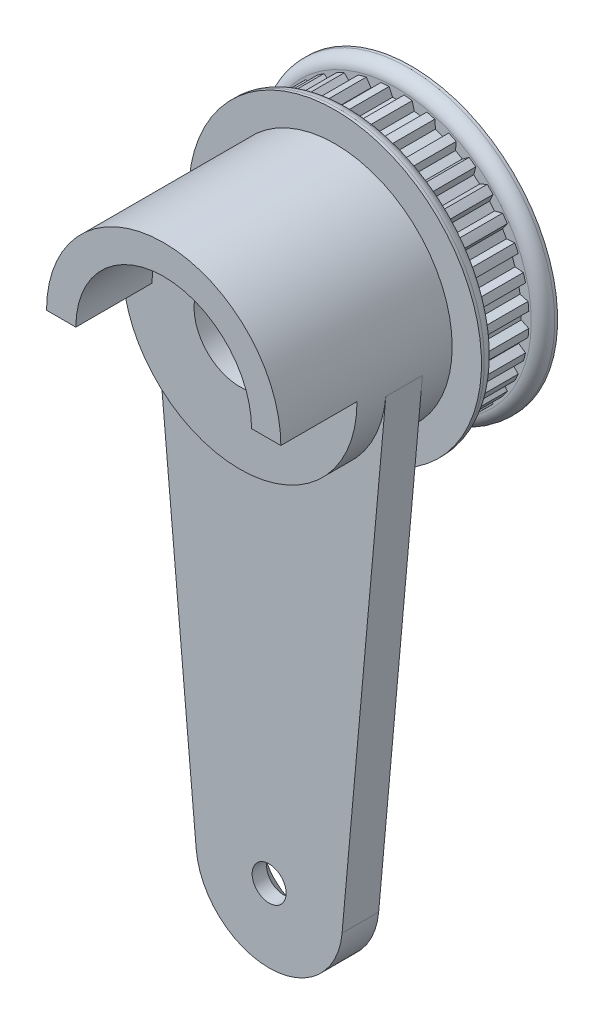
from build123d import *

# Parameters (mm, degrees)
SKETCH1_R                                         = 13.97
BOSS_EXTRUDE1_DEPTH                               = 12.7
SKETCH2_W                                         = 11.176
SKETCH2_H                                         = 10.668
FILLET2_R                                         = 0.2794
CUT_EXTRUDE1_DEPTH                                = 31.990081987
FILLET1_R                                         = 0.5984748
CIRPATTERN1_COUNT                                 = 20
FILLET1_OF_CIRPATTERN1_R                          = 0.5984748
SKETCH5_R                                         = 6.35
CUT_EXTRUDE2_DEPTH                                = 31.978829136
CHAMFER1_SIZE                                     = 0.5334
SKETCH7_R                                         = 15.875
CUT_EXTRUDE6_DEPTH                                = 2.54
SKETCH6_R                                         = 15.875
CUT_EXTRUDE7_DEPTH                                = 16.5735
SKETCH9_R                                         = 6.35
SKETCH9_R_2                                       = 3.96875
BOSS_EXTRUDE3_DEPTH                               = 4.7625
BOSS_EXTRUDE2_START                               = 3.175
SKETCH8_R                                         = 3.96875
BOSS_EXTRUDE2_DEPTH                               = 3.175
BOSS_EXTRUDE4_START                               = 2.54
SKETCH10_R                                        = 10.16
SKETCH10_R_2                                      = 3.96875
BOSS_EXTRUDE4_DEPTH                               = 2.54
BOSS_EXTRUDE5_START                               = 6.604
BOSS_EXTRUDE5_DEPTH                               = 6.604
SKETCH13_R                                        = 15.875
CUT_EXTRUDE8_DEPTH                                = 4.7625
SKETCH18_R                                        = 10.16
SKETCH18_R_2                                      = 3.96875
BOSS_EXTRUDE10_DEPTH                              = 2.54
SKETCH16_R                                        = 12.7
SKETCH16_R_2                                      = 3.96875
BOSS_EXTRUDE8_DEPTH                               = 1.27
SKETCH14_R                                        = 3.96875
BOSS_EXTRUDE6_DEPTH                               = 4.064
SKETCH15_R                                        = 12.7
SKETCH15_R_2                                      = 3.96875
BOSS_EXTRUDE7_DEPTH                               = 1.27
FILLET3_R                                         = 1.016
CSK_FOR_4_FLAT_HEAD_MACHINE_SCREW_100_D           = 2.9464
CSK_FOR_4_FLAT_HEAD_MACHINE_SCREW_100_CSINK_D     = 7.531227
CSK_FOR_4_FLAT_HEAD_MACHINE_SCREW_100_CSINK_ANGLE = 100


with BuildPart() as part:
    # Sketch1 → Boss-Extrude1 (new body)
    with BuildSketch(Plane.XY):
        Circle(SKETCH1_R)
    extrude(amount=-BOSS_EXTRUDE1_DEPTH)

    # Sketch2 → Revolve1 (revolve)
    with BuildSketch(Plane(origin=(0, 0, 0), x_dir=(0, 0, -1), z_dir=(1, 0, 0)), mode=Mode.PRIVATE) as revolve1_sk:
        with Locations((18.288, 5.334)):
            Rectangle(SKETCH2_W, SKETCH2_H)
    revolve(revolve1_sk.sketch.rotate(Axis((0, 0, -12.7), (0, 0, -1)), 90), axis=Axis((0, 0, -12.7), (0, 0, -1)))

    # Fillet2
    fillet2_edges = [part.edges().sort_by_distance(p)[0] for p in [
        (-13.97, 0, 0),
        (-13.97, 0, -12.7),
        (-10.668, 0, -12.7),
    ]]
    fillet(fillet2_edges, radius=FILLET2_R)

    # Sketch4 → Cut-Extrude1 (cut, through all)
    with BuildSketch(Plane.XY):
        with BuildLine():
            Line((0.210823499, 11.932233972), (0.210823499, 11.228631013))
            ThreePointArc((0.210823499, 11.228631013), (0.881145561, 11.195989616), (1.54832106, 11.123367425))
            Line((1.54832106, 11.123367425), (1.658389068, 11.818307824))
            add(Edge.make_bspline(
                [(5.904499611, 15.819097373), (2.715567633, 14.578951978), (1.658389068, 11.818307824)],
                knots=[0, 0, 0, 1, 1, 1], degree=2))
            ThreePointArc((5.904499611, 15.819097373), (1.324793594, 16.833059119), (-3.35714731, 16.548006506))
            add(Edge.make_bspline(
                [(-3.35714731, 16.548006506), (-0.40147849, 14.824269404), (0.210823499, 11.932233972)],
                knots=[0, 0, 0, 1, 1, 1], degree=2))
        make_face()
    cut_extrude1 = extrude(amount=-CUT_EXTRUDE1_DEPTH, mode=Mode.SUBTRACT)

    # Fillet1
    fillet1_edges = [part.edges().sort_by_distance(p)[0] for p in [
        (1.54832106, 11.123367425, -6.35),
        (0.210823499, 11.228631013, -6.35),
    ]]
    fillet(fillet1_edges, radius=FILLET1_R)

    # CirPattern1: Cut-Extrude1 ×20 about axis
    cirpattern1_axis = Axis((0, 0, -12.7), (0, 0, 1))
    for i in range(1, CIRPATTERN1_COUNT):
        add(cut_extrude1.rotate(cirpattern1_axis, i * 360 / CIRPATTERN1_COUNT), mode=Mode.SUBTRACT)

    # Fillet1 of CirPattern1
    fillet1_of_cirpattern1_edges = [part.edges().sort_by_distance(p)[0] for p in [
        (-1.964768736, 11.057408593, -6.35),
        (-3.269332744, 10.744210738, -6.35),
        (-5.285533278, 9.909073566, -6.35),
        (-6.429463919, 9.208072256, -6.35),
        (-8.088912997, 7.790769378, -6.35),
        (-8.96023437, 6.770583506, -6.35),
        (-10.100493552, 4.909850402, -6.35),
        (-10.61391465, 3.670342869, -6.35),
        (-11.123367425, 1.54832106, -6.35),
        (-11.228631013, 0.210823499, -6.35),
        (-11.057408593, -1.964768736, -6.35),
        (-10.744210738, -3.269332744, -6.35),
        (-9.909073566, -5.285533278, -6.35),
        (-9.208072256, -6.429463919, -6.35),
        (-7.790769378, -8.088912997, -6.35),
        (-6.770583506, -8.96023437, -6.35),
        (-4.909850402, -10.100493552, -6.35),
        (-3.670342869, -10.61391465, -6.35),
        (-1.54832106, -11.123367425, -6.35),
        (-0.210823499, -11.228631013, -6.35),
        (1.964768736, -11.057408593, -6.35),
        (3.269332744, -10.744210738, -6.35),
        (5.285533278, -9.909073566, -6.35),
        (6.429463919, -9.208072256, -6.35),
        (8.088912997, -7.790769378, -6.35),
        (8.96023437, -6.770583506, -6.35),
        (10.100493552, -4.909850402, -6.35),
        (10.61391465, -3.670342869, -6.35),
        (11.123367425, -1.54832106, -6.35),
        (11.228631013, -0.210823499, -6.35),
        (11.057408593, 1.964768736, -6.35),
        (10.744210738, 3.269332744, -6.35),
        (9.909073566, 5.285533278, -6.35),
        (9.208072256, 6.429463919, -6.35),
        (7.790769378, 8.088912997, -6.35),
        (6.770583506, 8.96023437, -6.35),
        (4.909850402, 10.100493552, -6.35),
        (3.670342869, 10.61391465, -6.35),
    ]]
    fillet(fillet1_of_cirpattern1_edges, radius=FILLET1_OF_CIRPATTERN1_R)

    # Sketch5 → Cut-Extrude2 (cut, through all)
    with BuildSketch(Plane.XY):
        Circle(SKETCH5_R)
    extrude(amount=-CUT_EXTRUDE2_DEPTH, mode=Mode.SUBTRACT)

    # Chamfer1
    chamfer1_edges = [part.edges().sort_by_distance(p)[0] for p in [
        (-10.668, 0, -23.876),
        (-6.35, 0, -23.876),
        (-6.35, 0, 0),
    ]]
    chamfer(chamfer1_edges, length=CHAMFER1_SIZE)

    # Sketch7 → Cut-Extrude6 (cut)
    with BuildSketch(Plane.XY):
        Circle(SKETCH7_R)
    extrude(amount=-CUT_EXTRUDE6_DEPTH, mode=Mode.SUBTRACT)

    # Sketch6 → Cut-Extrude7 (cut)
    with BuildSketch(Plane(origin=(0, 0, -23.876), x_dir=(-1, 0, 0), z_dir=(0, 0, -1))):
        Circle(SKETCH6_R)
    extrude(amount=-CUT_EXTRUDE7_DEPTH, mode=Mode.SUBTRACT)

    # Sketch9 → Boss-Extrude3 (add)
    with BuildSketch(Plane.XY.offset(-2.54)):
        Circle(SKETCH9_R)
        Circle(SKETCH9_R_2, mode=Mode.SUBTRACT)
    extrude(amount=-BOSS_EXTRUDE3_DEPTH)

    # Sketch8 → Boss-Extrude2 (add)
    with BuildSketch(Plane.XY.offset(-2.54).offset(BOSS_EXTRUDE2_START)):
        with BuildLine():
            Line((10.119178406, -0.909850746), (6.324486504, -43.113656716))
            ThreePointArc((6.324486504, -43.113656716), (0, -48.895), (-6.324486504, -43.113656716))
            Line((-6.324486504, -43.113656716), (-10.119178406, -0.909850746))
            ThreePointArc((-10.119178406, -0.909850746), (0, 10.16), (10.119178406, -0.909850746))
        make_face()
        Circle(SKETCH8_R, mode=Mode.SUBTRACT)
    extrude(amount=-BOSS_EXTRUDE2_DEPTH)

    # Sketch10 → Boss-Extrude4 (add)
    with BuildSketch(Plane.XY.offset(0.635).offset(BOSS_EXTRUDE4_START)):
        with Locations(Location((0, 0, 0), (0, 0, 185.137848249))):
            Circle(SKETCH10_R)
        Circle(SKETCH10_R_2, mode=Mode.SUBTRACT)
    extrude(amount=-BOSS_EXTRUDE4_DEPTH)

    # Sketch12 → Boss-Extrude5 (add)
    with BuildSketch(Plane.XY.offset(3.175).offset(BOSS_EXTRUDE5_START)):
        with BuildLine():
            Line((-10.16, 0), (-7.62, 0))
            ThreePointArc((-7.62, 0), (0, 7.62), (7.62, 0))
            Line((7.62, 0), (10.16, 0))
            ThreePointArc((10.16, 0), (0, 10.16), (-10.16, 0))
        make_face()
    extrude(amount=-BOSS_EXTRUDE5_DEPTH)

    # Sketch13 → Cut-Extrude8 (cut)
    with BuildSketch(Plane(origin=(0, 0, -7.3025), x_dir=(-1, 0, 0), z_dir=(0, 0, -1))):
        Circle(SKETCH13_R)
    extrude(amount=-CUT_EXTRUDE8_DEPTH, mode=Mode.SUBTRACT)

    # Sketch18 → Boss-Extrude10 (add)
    with BuildSketch(Plane(origin=(0, 0, -2.54), x_dir=(-1, 0, 0), z_dir=(0, 0, -1))):
        Circle(SKETCH18_R)
        with Locations(Location((0, 0, 0), (0, 0, 180))):
            Circle(SKETCH18_R_2, mode=Mode.SUBTRACT)
    extrude(amount=BOSS_EXTRUDE10_DEPTH)

    # Sketch16 → Boss-Extrude8 (add)
    with BuildSketch(Plane(origin=(0, 0, -5.08), x_dir=(-1, 0, 0), z_dir=(0, 0, -1))):
        Circle(SKETCH16_R)
        with Locations(Location((0, 0, 0), (0, 0, 180))):
            Circle(SKETCH16_R_2, mode=Mode.SUBTRACT)
    extrude(amount=BOSS_EXTRUDE8_DEPTH)

    # Sketch14 → Boss-Extrude6 (add)
    with BuildSketch(Plane(origin=(0, 0, -6.35), x_dir=(-1, 0, 0), z_dir=(0, 0, -1))):
        with BuildLine():
            Line((10.591943248, 2.211740116), (10.709630583, 1.544302071))
            Line((10.709630583, 1.544302071), (11.406652083, 1.357535723))
            ThreePointArc((11.406652083, 1.357535723), (11.44343792, 1.001171087), (11.469093012, 0.643832637))
            Line((11.469093012, 0.643832637), (10.815092471, 0.338867176))
            Line((10.815092471, 0.338867176), (10.815092471, -0.338867176))
            Line((10.815092471, -0.338867176), (11.469093012, -0.643832636))
            ThreePointArc((11.469093012, -0.643832636), (11.44343792, -1.001171091), (11.406652082, -1.357535731))
            Line((11.406652082, -1.357535731), (10.709630582, -1.544302079))
            Line((10.709630582, -1.544302079), (10.591943246, -2.211740123))
            Line((10.591943246, -2.211740123), (11.183051353, -2.625638476))
            ThreePointArc((11.183051353, -2.625638476), (11.095734849, -2.973093194), (10.9976258, -3.317656059))
            Line((10.9976258, -3.317656059), (10.278761988, -3.380548493))
            Line((10.278761988, -3.380548493), (10.046963187, -4.017410463))
            Line((10.046963187, -4.017410463), (10.557218339, -4.527665614))
            ThreePointArc((10.557218339, -4.527665614), (10.41089349, -4.854679363), (10.254442225, -5.176971087))
            Line((10.254442225, -5.176971087), (9.535578412, -5.114078652))
            Line((9.535578412, -5.114078652), (9.196711236, -5.701013818))
            Line((9.196711236, -5.701013818), (9.610609588, -6.292121925))
            ThreePointArc((9.610609588, -6.292121925), (9.409722401, -6.588758556), (9.199682612, -6.878986467))
            Line((9.199682612, -6.878986467), (8.502661112, -6.692220119))
            Line((8.502661112, -6.692220119), (8.067021868, -7.211394754))
            Line((8.067021868, -7.211394754), (8.371987329, -7.865395295))
            ThreePointArc((8.371987329, -7.865395295), (8.122641656, -8.122641658), (7.865395293, -8.37198733))
            Line((7.865395293, -8.37198733), (7.211394752, -8.067021869))
            Line((7.211394752, -8.067021869), (6.692220118, -8.502661113))
            Line((6.692220118, -8.502661113), (6.878986466, -9.199682613))
            ThreePointArc((6.878986466, -9.199682613), (6.588758556, -9.409722401), (6.292121926, -9.610609588))
            Line((6.292121926, -9.610609588), (5.701013819, -9.196711235))
            Line((5.701013819, -9.196711235), (5.114078653, -9.535578411))
            Line((5.114078653, -9.535578411), (5.176971087, -10.254442224))
            ThreePointArc((5.176971087, -10.254442224), (4.854679362, -10.41089349), (4.527665612, -10.55721834))
            Line((4.527665612, -10.55721834), (4.017410461, -10.046963188))
            Line((4.017410461, -10.046963188), (3.380548491, -10.278761988))
            Line((3.380548491, -10.278761988), (3.317656057, -10.997625801))
            ThreePointArc((3.317656057, -10.997625801), (2.97309319, -11.09573485), (2.62563847, -11.183051355))
            Line((2.62563847, -11.183051355), (2.211740117, -10.591943248))
            Line((2.211740117, -10.591943248), (1.544302073, -10.709630583))
            Line((1.544302073, -10.709630583), (1.357535725, -11.406652082))
            ThreePointArc((1.357535725, -11.406652082), (1.001171088, -11.44343792), (0.643832637, -11.469093012))
            Line((0.643832637, -11.469093012), (0.338867176, -10.815092471))
            Line((0.338867176, -10.815092471), (-0.338867176, -10.815092471))
            Line((-0.338867176, -10.815092471), (-0.643832637, -11.469093012))
            ThreePointArc((-0.643832637, -11.469093012), (-1.00117109, -11.44343792), (-1.357535729, -11.406652082))
            Line((-1.357535729, -11.406652082), (-1.544302077, -10.709630582))
            Line((-1.544302077, -10.709630582), (-2.211740121, -10.591943247))
            Line((-2.211740121, -10.591943247), (-2.625638473, -11.183051354))
            ThreePointArc((-2.625638473, -11.183051354), (-2.973093192, -11.095734849), (-3.317656058, -10.997625801))
            Line((-3.317656058, -10.997625801), (-3.380548492, -10.278761988))
            Line((-3.380548492, -10.278761988), (-4.017410461, -10.046963188))
            Line((-4.017410461, -10.046963188), (-4.527665613, -10.557218339))
            ThreePointArc((-4.527665613, -10.557218339), (-4.854679361, -10.410893491), (-5.176971084, -10.254442226))
            Line((-5.176971084, -10.254442226), (-5.11407865, -9.535578413))
            Line((-5.11407865, -9.535578413), (-5.701013816, -9.196711237))
            Line((-5.701013816, -9.196711237), (-6.292121923, -9.61060959))
            ThreePointArc((-6.292121923, -9.61060959), (-6.588758555, -9.409722402), (-6.878986466, -9.199682612))
            Line((-6.878986466, -9.199682612), (-6.692220118, -8.502661113))
            Line((-6.692220118, -8.502661113), (-7.211394753, -8.067021869))
            Line((-7.211394753, -8.067021869), (-7.865395294, -8.37198733))
            ThreePointArc((-7.865395294, -8.37198733), (-8.122641656, -8.122641658), (-8.371987327, -7.865395296))
            Line((-8.371987327, -7.865395296), (-8.067021866, -7.211394755))
            Line((-8.067021866, -7.211394755), (-8.502661111, -6.692220121))
            Line((-8.502661111, -6.692220121), (-9.19968261, -6.878986469))
            ThreePointArc((-9.19968261, -6.878986469), (-9.4097224, -6.588758557), (-9.610609588, -6.292121925))
            Line((-9.610609588, -6.292121925), (-9.196711236, -5.701013818))
            Line((-9.196711236, -5.701013818), (-9.535578412, -5.114078653))
            Line((-9.535578412, -5.114078653), (-10.254442225, -5.176971087))
            ThreePointArc((-10.254442225, -5.176971087), (-10.410893489, -4.854679364), (-10.557218338, -4.527665616))
            Line((-10.557218338, -4.527665616), (-10.046963187, -4.017410464))
            Line((-10.046963187, -4.017410464), (-10.278761987, -3.380548494))
            Line((-10.278761987, -3.380548494), (-10.9976258, -3.31765606))
            ThreePointArc((-10.9976258, -3.31765606), (-11.095734849, -2.973093194), (-11.183051353, -2.625638475))
            Line((-11.183051353, -2.625638475), (-10.591943247, -2.211740123))
            Line((-10.591943247, -2.211740123), (-10.709630582, -1.544302078))
            Line((-10.709630582, -1.544302078), (-11.406652082, -1.35753573))
            ThreePointArc((-11.406652082, -1.35753573), (-11.44343792, -1.00117109), (-11.469093012, -0.643832637))
            Line((-11.469093012, -0.643832637), (-10.815092471, -0.338867176))
            Line((-10.815092471, -0.338867176), (-10.815092471, 0.338867176))
            Line((-10.815092471, 0.338867176), (-11.469093012, 0.643832637))
            ThreePointArc((-11.469093012, 0.643832637), (-11.44343792, 1.001171089), (-11.406652082, 1.357535726))
            Line((-11.406652082, 1.357535726), (-10.709630582, 1.544302074))
            Line((-10.709630582, 1.544302074), (-10.591943248, 2.211740119))
            Line((-10.591943248, 2.211740119), (-11.183051354, 2.625638471))
            ThreePointArc((-11.183051354, 2.625638471), (-11.09573485, 2.97309319), (-10.997625801, 3.317656056))
            Line((-10.997625801, 3.317656056), (-10.278761988, 3.38054849))
            Line((-10.278761988, 3.38054849), (-10.046963188, 4.01741046))
            Line((-10.046963188, 4.01741046), (-10.55721834, 4.527665612))
            ThreePointArc((-10.55721834, 4.527665612), (-10.410893491, 4.85467936), (-10.254442226, 5.176971083))
            Line((-10.254442226, 5.176971083), (-9.535578413, 5.114078649))
            Line((-9.535578413, 5.114078649), (-9.196711238, 5.701013815))
            Line((-9.196711238, 5.701013815), (-9.61060959, 6.292121922))
            ThreePointArc((-9.61060959, 6.292121922), (-9.409722402, 6.588758554), (-9.199682613, 6.878986465))
            Line((-9.199682613, 6.878986465), (-8.502661114, 6.692220117))
            Line((-8.502661114, 6.692220117), (-8.06702187, 7.211394752))
            Line((-8.06702187, 7.211394752), (-8.371987331, 7.865395293))
            ThreePointArc((-8.371987331, 7.865395293), (-8.122641658, 8.122641656), (-7.865395295, 8.371987328))
            Line((-7.865395295, 8.371987328), (-7.211394754, 8.067021868))
            Line((-7.211394754, 8.067021868), (-6.69222012, 8.502661112))
            Line((-6.69222012, 8.502661112), (-6.878986468, 9.199682611))
            ThreePointArc((-6.878986468, 9.199682611), (-6.588758558, 9.4097224), (-6.292121927, 9.610609587))
            Line((-6.292121927, 9.610609587), (-5.70101382, 9.196711234))
            Line((-5.70101382, 9.196711234), (-5.114078655, 9.53557841))
            Line((-5.114078655, 9.53557841), (-5.176971089, 10.254442223))
            ThreePointArc((-5.176971089, 10.254442223), (-4.854679364, 10.410893489), (-4.527665614, 10.557218339))
            Line((-4.527665614, 10.557218339), (-4.017410463, 10.046963187))
            Line((-4.017410463, 10.046963187), (-3.380548493, 10.278761988))
            Line((-3.380548493, 10.278761988), (-3.317656058, 10.997625801))
            ThreePointArc((-3.317656058, 10.997625801), (-2.973093191, 11.095734849), (-2.625638471, 11.183051354))
            Line((-2.625638471, 11.183051354), (-2.211740119, 10.591943248))
            Line((-2.211740119, 10.591943248), (-1.544302074, 10.709630582))
            Line((-1.544302074, 10.709630582), (-1.357535726, 11.406652082))
            ThreePointArc((-1.357535726, 11.406652082), (-1.001171089, 11.44343792), (-0.643832637, 11.469093012))
            Line((-0.643832637, 11.469093012), (-0.338867176, 10.815092471))
            Line((-0.338867176, 10.815092471), (0.338867176, 10.815092471))
            Line((0.338867176, 10.815092471), (0.643832636, 11.469093012))
            ThreePointArc((0.643832636, 11.469093012), (1.001171088, 11.44343792), (1.357535726, 11.406652082))
            Line((1.357535726, 11.406652082), (1.544302074, 10.709630583))
            Line((1.544302074, 10.709630583), (2.211740118, 10.591943248))
            Line((2.211740118, 10.591943248), (2.62563847, 11.183051354))
            ThreePointArc((2.62563847, 11.183051354), (2.973093192, 11.095734849), (3.31765606, 10.9976258))
            Line((3.31765606, 10.9976258), (3.380548494, 10.278761987))
            Line((3.380548494, 10.278761987), (4.017410463, 10.046963187))
            Line((4.017410463, 10.046963187), (4.527665616, 10.557218338))
            ThreePointArc((4.527665616, 10.557218338), (4.854679365, 10.410893489), (5.176971089, 10.254442223))
            Line((5.176971089, 10.254442223), (5.114078655, 9.535578411))
            Line((5.114078655, 9.535578411), (5.701013821, 9.196711234))
            Line((5.701013821, 9.196711234), (6.292121927, 9.610609586))
            ThreePointArc((6.292121927, 9.610609586), (6.588758558, 9.4097224), (6.878986467, 9.199682612))
            Line((6.878986467, 9.199682612), (6.692220119, 8.502661112))
            Line((6.692220119, 8.502661112), (7.211394754, 8.067021868))
            Line((7.211394754, 8.067021868), (7.865395294, 8.371987329))
            ThreePointArc((7.865395294, 8.371987329), (8.122641658, 8.122641656), (8.371987331, 7.865395292))
            Line((8.371987331, 7.865395292), (8.06702187, 7.211394752))
            Line((8.06702187, 7.211394752), (8.502661114, 6.692220117))
            Line((8.502661114, 6.692220117), (9.199682613, 6.878986465))
            ThreePointArc((9.199682613, 6.878986465), (9.409722401, 6.588758555), (9.610609588, 6.292121925))
            Line((9.610609588, 6.292121925), (9.196711236, 5.701013818))
            Line((9.196711236, 5.701013818), (9.535578412, 5.114078652))
            Line((9.535578412, 5.114078652), (10.254442225, 5.176971087))
            ThreePointArc((10.254442225, 5.176971087), (10.41089349, 4.854679362), (10.55721834, 4.527665612))
            Line((10.55721834, 4.527665612), (10.046963188, 4.017410461))
            Line((10.046963188, 4.017410461), (10.278761988, 3.380548491))
            Line((10.278761988, 3.380548491), (10.997625801, 3.317656057))
            ThreePointArc((10.997625801, 3.317656057), (11.09573485, 2.973093189), (11.183051355, 2.625638468))
            Line((11.183051355, 2.625638468), (10.591943248, 2.211740116))
        make_face()
        with Locations(Location((0, 0, 0), (0, 0, 180))):
            Circle(SKETCH14_R, mode=Mode.SUBTRACT)
    extrude(amount=BOSS_EXTRUDE6_DEPTH)

    # Sketch15 → Boss-Extrude7 (add)
    with BuildSketch(Plane(origin=(0, 0, -10.414), x_dir=(-1, 0, 0), z_dir=(0, 0, -1))):
        Circle(SKETCH15_R)
        with Locations(Location((0, 0, 0), (0, 0, 180))):
            Circle(SKETCH15_R_2, mode=Mode.SUBTRACT)
    extrude(amount=BOSS_EXTRUDE7_DEPTH)

    # Fillet3
    fillet3_edges = [part.edges().sort_by_distance(p)[0] for p in [
        (12.7, 0, -6.35),
        (12.7, 0, -10.414),
    ]]
    fillet(fillet3_edges, radius=FILLET3_R)

    # CSK for #4 Flat Head Machine Screw (100)1 (through all)
    with Locations(Plane(origin=(0, 0, -2.54), x_dir=(-1, 0, 0), z_dir=(0, 0, -1))):
        with Locations((0, -42.545)):
            CounterSinkHole(CSK_FOR_4_FLAT_HEAD_MACHINE_SCREW_100_D / 2, CSK_FOR_4_FLAT_HEAD_MACHINE_SCREW_100_CSINK_D / 2, counter_sink_angle=CSK_FOR_4_FLAT_HEAD_MACHINE_SCREW_100_CSINK_ANGLE)


solid = part.part
